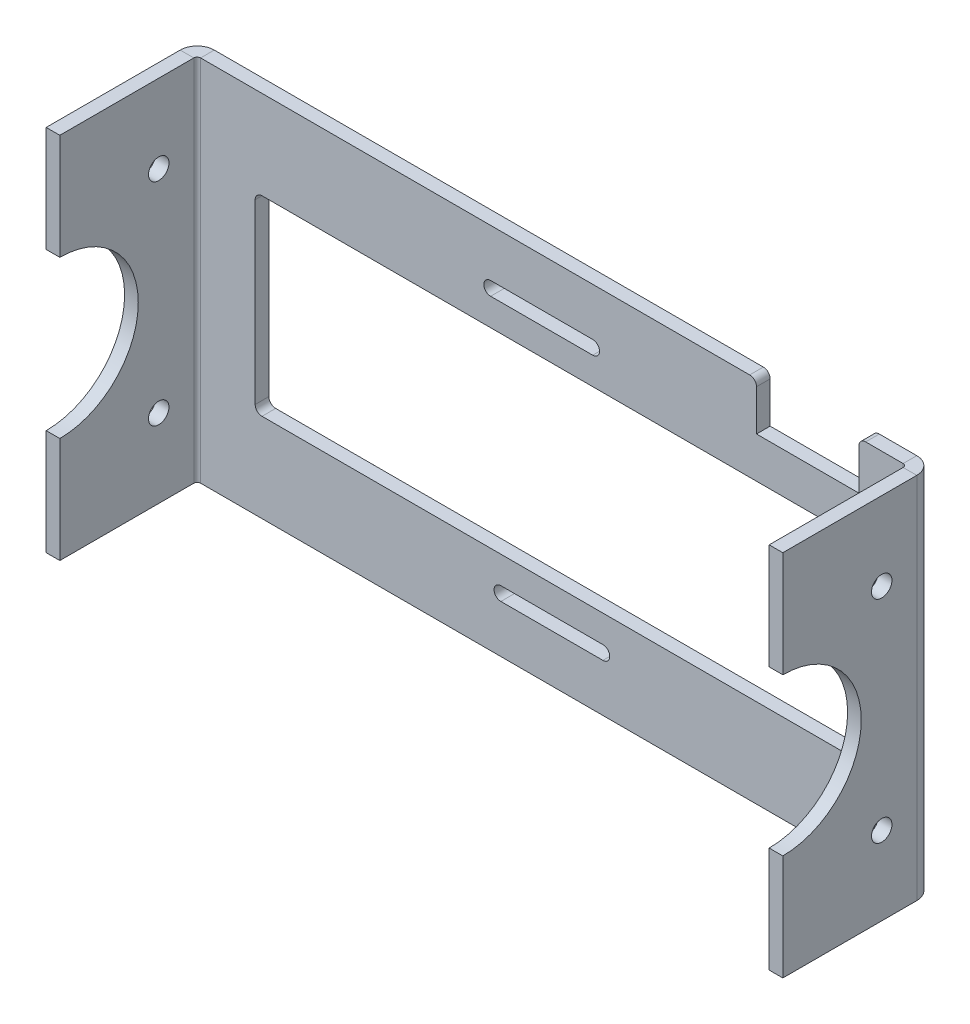
from build123d import *
from build123d.topology import SkipClean

# Parameters (mm, degrees)
DODANIE_WYCI_GNI_CIE1_DEPTH = 2
SZKIC_START                 = -28.065385
SZKIC_ZGI_CIA1_DEPTH        = 54
SZKIC_ZGI_CIA1_2_DEPTH      = 15.5
SZKIC_START_2               = 10.434615
SZKIC_ZGI_CIA1_3_DEPTH      = 15.5
SZKIC_START_3               = -56.031828
SZKIC_ZGI_CIA1_4_DEPTH      = 2.423909
SZKIC_START_4               = -12.565385
SZKIC_ZGI_CIA1_5_DEPTH      = 23
SZKIC_ZGI_CIA1_6_DEPTH      = 23
SZKIC_ZGI_CIA2_DEPTH        = 54
SZKIC_ZGI_CIA2_2_DEPTH      = 54
SZKIC_START_5               = 49.968172
SZKIC_ZGI_CIA2_3_DEPTH      = 2
SZKIC9_W                    = 87
SZKIC9_H                    = 28
SZKIC9_W_2                  = 15
SZKIC9_H_2                  = 7
WYTNIJ_WYCI_GNI_CIE1_DEPTH  = 66.825561
SZKIC10_R                   = 1.5
WYTNIJ_WYCI_GNI_CIE2_DEPTH  = 114.762973
ZAOKR_GLENIE2_R             = 1
ZAOKR_GLENIE3_R             = 1


with BuildPart() as part:
    # Szkic1 → Dodanie-wyciągnięcie1 (new body)
    with BuildSketch(Plane.XY):
        with BuildLine():
            Line((-75.531828, 25.934615), (71.468172, 25.934615))
            Line((71.468172, 25.934615), (71.468172, 10.434615))
            ThreePointArc((71.468172, 10.434615), (59.968172, -1.065385), (71.468172, -12.565385))
            Line((71.468172, -12.565385), (71.468172, -28.065385))
            Line((71.468172, -28.065385), (-75.531828, -28.065385))
            Line((-75.531828, -28.065385), (-75.531828, -12.565385))
            ThreePointArc((-75.531828, -12.565385), (-64.031828, -1.065385), (-75.531828, 10.434615))
            Line((-75.531828, 10.434615), (-75.531828, 25.934615))
        make_face()
    extrude(amount=DODANIE_WYCI_GNI_CIE1_DEPTH)

    # Szkic zgięcia1: read off the stored shape, not the designer's step
    # Szkic zgięcia1 outline → Szkic zgięcia1 (cut)
    with BuildSketch(Plane(origin=(0, 0, 0), x_dir=(1, 0, 0), z_dir=(0, 1, 0)).offset(SZKIC_START)):
        with BuildLine():
            Line((-75.531828, -2), (-55.981318, -2))
            ThreePointArc((-55.981318, -2), (-55.112967, -0.563508), (-53.531828, 0))
            Line((-53.531828, 0), (-75.531828, 0))
            Line((-75.531828, 0), (-75.531828, -2))
        make_face()
    extrude(amount=SZKIC_ZGI_CIA1_DEPTH, mode=Mode.SUBTRACT)

    # Szkic zgi_cia1 2 outline → Szkic zgi_cia1 2 (add)
    with BuildSketch(Plane(origin=(0, 0, 0), x_dir=(1, 0, 0), z_dir=(0, 1, 0)).offset(SZKIC_START)):
        with BuildLine():
            ThreePointArc((-55.981318, -2), (-56.019168, -2.248728), (-56.031828, -2.5))
            Line((-56.031828, -2.5), (-56.031828, -22.143806))
            Line((-56.031828, -22.143806), (-54.031828, -22.143806))
            Line((-54.031828, -22.143806), (-54.031828, -2.5))
            ThreePointArc((-54.031828, -2.5), (-53.885381, -2.146447), (-53.531828, -2))
            Line((-53.531828, -2), (-55.981318, -2))
        make_face()
    extrude(amount=SZKIC_ZGI_CIA1_2_DEPTH)

    # Szkic zgi_cia1 3 outline → Szkic zgi_cia1 3 (add)
    with BuildSketch(Plane(origin=(0, 0, 0), x_dir=(1, 0, 0), z_dir=(0, 1, 0)).offset(SZKIC_START_2)):
        with BuildLine():
            ThreePointArc((-55.981318, -2), (-56.019168, -2.248728), (-56.031828, -2.5))
            Line((-56.031828, -2.5), (-56.031828, -22.143806))
            Line((-56.031828, -22.143806), (-54.031828, -22.143806))
            Line((-54.031828, -22.143806), (-54.031828, -2.5))
            ThreePointArc((-54.031828, -2.5), (-53.885381, -2.146447), (-53.531828, -2))
            Line((-53.531828, -2), (-55.981318, -2))
        make_face()
    extrude(amount=SZKIC_ZGI_CIA1_3_DEPTH)

    # Szkic zgi_cia1 4 outline → Szkic zgi_cia1 4 (add)
    with BuildSketch(Plane.YZ.offset(SZKIC_START_3)):
        with BuildLine():
            Line((10.434615, 2), (10.434615, 22.143806))
            ThreePointArc((10.434615, 22.143806), (-1.065385, 10.643806), (-12.565385, 22.143806))
            Line((-12.565385, 22.143806), (-12.565385, 2))
            Line((-12.565385, 2), (10.434615, 2))
        make_face()
    extrude(amount=SZKIC_ZGI_CIA1_4_DEPTH)

    # Szkic zgi_cia1 5 outline → Szkic zgi_cia1 5 (cut)
    with SkipClean():  # the faces are left unmerged after this step: merging them gives an invalid solid
        with BuildSketch(Plane(origin=(0, 0, 0), x_dir=(1, 0, 0), z_dir=(0, 1, 0)).offset(SZKIC_START_4)):
            with BuildLine():
                ThreePointArc((-53.607919, -2.005824), (-53.911331, -2.174459), (-54.031828, -2.5))
                Line((-54.031828, -2.5), (-54.031828, -24))
                Line((-54.031828, -24), (-53.607919, -24))
                Line((-53.607919, -24), (-53.607919, -2.005824))
            make_face()
            with BuildLine():
                Line((-58, -24), (-56.031828, -24))
                Line((-56.031828, -24), (-56.031828, -2.5))
                ThreePointArc((-56.031828, -2.5), (-56.019168, -2.248728), (-55.981318, -2))
                Line((-55.981318, -2), (-58, -2))
                Line((-58, -2), (-58, -24))
            make_face()
        extrude(amount=SZKIC_ZGI_CIA1_5_DEPTH, mode=Mode.SUBTRACT)

    # Szkic zgi_cia1 6 outline → Szkic zgi_cia1 6 (add)
    with SkipClean():  # the faces are left unmerged after this step: merging them gives an invalid solid
        with BuildSketch(Plane(origin=(0, 0, 0), x_dir=(1, 0, 0), z_dir=(0, 1, 0)).offset(SZKIC_START_4)):
            with BuildLine():
                Line((-53.607919, -2), (-53.607919, -2.005824))
                ThreePointArc((-53.607919, -2.005824), (-53.569985, -2.001458), (-53.531828, -2))
                Line((-53.531828, -2), (-53.607919, -2))
            make_face()
        extrude(amount=SZKIC_ZGI_CIA1_6_DEPTH)

    # Szkic zgięcia2: read off the stored shape, not the designer's step
    # Szkic zgięcia2 outline → Szkic zgięcia2 (cut)
    with SkipClean():  # the faces are left unmerged after this step: merging them gives an invalid solid
        with BuildSketch(Plane(origin=(0, 0, 0), x_dir=(1, 0, 0), z_dir=(0, 1, 0)).offset(SZKIC_START)):
            with BuildLine():
                ThreePointArc((49.468172, 0), (51.049311, -0.563508), (51.917662, -2))
                Line((51.917662, -2), (71.468172, -2))
                Line((71.468172, -2), (71.468172, 0))
                Line((71.468172, 0), (49.468172, 0))
            make_face()
        extrude(amount=SZKIC_ZGI_CIA2_DEPTH, mode=Mode.SUBTRACT)

    # Szkic zgi_cia2 2 outline → Szkic zgi_cia2 2 (add)
    with SkipClean():  # the faces are left unmerged after this step: merging them gives an invalid solid
        with BuildSketch(Plane(origin=(0, 0, 0), x_dir=(1, 0, 0), z_dir=(0, 1, 0)).offset(SZKIC_START)):
            with BuildLine():
                Line((49.968172, -22.143806), (51.968172, -22.143806))
                Line((51.968172, -22.143806), (51.968172, -2.5))
                ThreePointArc((51.968172, -2.5), (51.955512, -2.248728), (51.917662, -2))
                Line((51.917662, -2), (49.468172, -2))
                ThreePointArc((49.468172, -2), (49.821725, -2.146447), (49.968172, -2.5))
                Line((49.968172, -2.5), (49.968172, -22.143806))
            make_face()
        extrude(amount=SZKIC_ZGI_CIA2_2_DEPTH)

    # Szkic zgi_cia2 3 outline → Szkic zgi_cia2 3 (cut)
    with SkipClean():  # the faces are left unmerged after this step: merging them gives an invalid solid
        with BuildSketch(Plane.YZ.offset(SZKIC_START_5)):
            with BuildLine():
                Line((10.434615, 22.143806), (-12.565385, 22.143806))
                ThreePointArc((-12.565385, 22.143806), (-1.065385, 10.643806), (10.434615, 22.143806))
            make_face()
        extrude(amount=SZKIC_ZGI_CIA2_3_DEPTH, mode=Mode.SUBTRACT)

    # Szkic9 → Wytnij-wyciągnięcie1 (cut, through all)
    with SkipClean():  # the faces are left unmerged after this step: merging them gives an invalid solid
        with BuildSketch(Plane.XY.offset(2)):
            with Locations((-2.031828, -1.065385)):
                Rectangle(SZKIC9_W, SZKIC9_H)
            with Locations((35.468172, 22.434615)):
                Rectangle(SZKIC9_W_2, SZKIC9_H_2)
            with BuildLine():
                Line((-11.015655, 18.934615), (3.951999, 18.934615))
                ThreePointArc((3.951999, 18.934615), (4.951999, 17.934615), (3.951999, 16.934615))
                Line((3.951999, 16.934615), (-11.015655, 16.934615))
                ThreePointArc((-11.015655, 16.934615), (-12.015655, 17.934615), (-11.015655, 18.934615))
            make_face()
            with BuildLine():
                Line((-9.515655, -19.065385), (5.451999, -19.065385))
                ThreePointArc((5.451999, -19.065385), (6.451999, -20.065385), (5.451999, -21.065385))
                Line((5.451999, -21.065385), (-9.515655, -21.065385))
                ThreePointArc((-9.515655, -21.065385), (-10.515655, -20.065385), (-9.515655, -19.065385))
            make_face()
        extrude(amount=-WYTNIJ_WYCI_GNI_CIE1_DEPTH, mode=Mode.SUBTRACT)

    # Szkic10 → Wytnij-wyciągnięcie2 (cut, through all)
    with SkipClean():  # the faces are left unmerged after this step: merging them gives an invalid solid
        with BuildSketch(Plane.ZY.offset(56.031828)):
            with Locations((7.643806, 14.434615)):
                Circle(SZKIC10_R)
            with Locations((7.643806, -16.565385)):
                Circle(SZKIC10_R)
        extrude(amount=-WYTNIJ_WYCI_GNI_CIE2_DEPTH, mode=Mode.SUBTRACT)

    # Zaokrąglenie2
    zaokr_glenie2_edges = [part.edges().sort_by_distance(p)[0] for p in [
        (27.968172, 25.934615, 1),
        (42.968172, 25.934615, 1),
    ]]
    fillet(zaokr_glenie2_edges, radius=ZAOKR_GLENIE2_R)

    # Zaokrąglenie3
    zaokr_glenie3_edges = [part.edges().sort_by_distance(p)[0] for p in [
        (-45.531828, -15.065385, 1),
        (-45.531828, 12.934615, 1),
        (41.468172, 12.934615, 1),
        (41.468172, -15.065385, 1),
    ]]
    fillet(zaokr_glenie3_edges, radius=ZAOKR_GLENIE3_R)


solid = part.part
